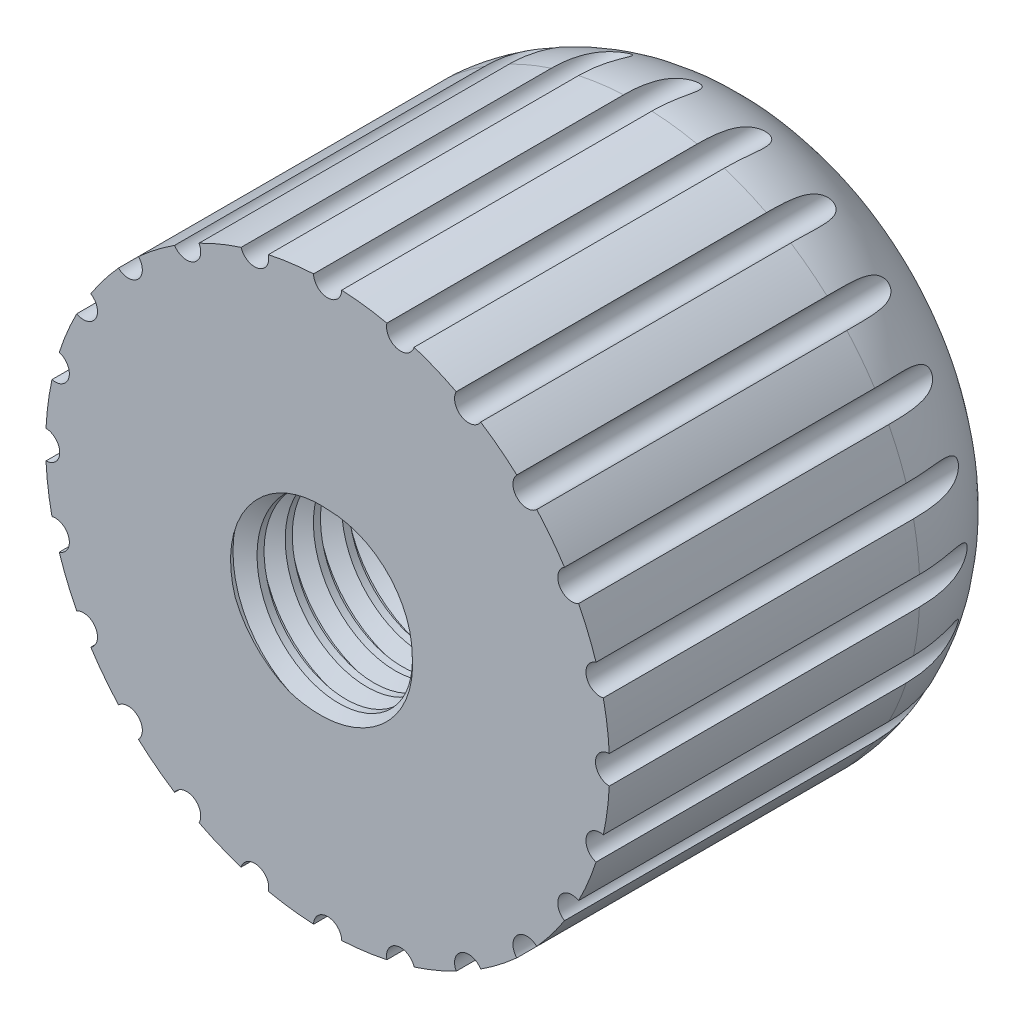
from build123d import *

# Parameters (mm, degrees)
SKETCH1_R           = 10
BOSS_EXTRUDE1_DEPTH = 16
SKETCH2_R           = 3
CUT_EXTRUDE1_DEPTH  = 12
THREAD1_PITCH       = 1
FILLET1_R           = 5
SKETCH6_R           = 0.5
CUT_EXTRUDE2_DEPTH  = 20
CIRPATTERN1_START   = -1e-07
CIRPATTERN1_DEPTH   = 17.0000001


with BuildPart() as part:
    # Sketch1 → Boss-Extrude1 (new body)
    with BuildSketch(Plane.XY):
        Circle(SKETCH1_R)
    extrude(amount=BOSS_EXTRUDE1_DEPTH)

    # Sketch2 → Cut-Extrude1 (cut)
    with BuildSketch(Plane.XY.offset(16)):
        Circle(SKETCH2_R)
    extrude(amount=-CUT_EXTRUDE1_DEPTH, mode=Mode.SUBTRACT)

    # Thread1: arcs per turn and ends read off the stored shape
    # Thread1: the profile of Thread Profile1 profile screwed along a right-hand helix through 12 turns, 8 arcs to a turn; built about Z, then put on its axis
    thread1_z = Axis((0, 0, 0), (0, 0, 1))
    thread1_corners = [(2.9997, 0, -0.000173205), (3.541265875, 0, 0.312499999), (3.541265875, 0, 0.437499999), (2.9997, 0, 0.750173202)]
    with BuildLine(mode=Mode.PRIVATE) as thread1_profile:
        Line(thread1_corners[0], thread1_corners[1])
        Line(thread1_corners[1], thread1_corners[2])
        Line(thread1_corners[2], thread1_corners[3])
        Line(thread1_corners[3], thread1_corners[0])
    thread1_cap = Face(thread1_profile.wire())
    thread1_turn_angles = [0, 22.5, 45, 67.5, 90, 112.5, 135, 157.5, 180, 202.5, 225, 247.5, 270, 292.5, 315, 337.5, 360]
    thread1_turn_weights = [1, 0.9238795325112867, 1, 0.9238795325112867, 1, 0.9238795325112867, 1, 0.9238795325112867, 1, 0.9238795325112867, 1, 0.9238795325112867, 1, 0.9238795325112867, 1, 0.9238795325112867, 1]
    thread1_turn_rails = [Edge.make_bspline([Vector(p[0], p[1], 0).rotate(thread1_z, thread1_turn_angles[k]) / thread1_turn_weights[k] + Vector(0, 0, p[2] + THREAD1_PITCH * thread1_turn_angles[k] / 360) for k in range(17)], [0, 0, 0, 1, 1, 2, 2, 3, 3, 4, 4, 5, 5, 6, 6, 7, 7, 8, 8, 8], 2, thread1_turn_weights) for p in thread1_corners]
    thread1_turn_sides = [Face.make_surface_from_curves(thread1_turn_rails[p[0]], thread1_turn_rails[p[1]]) for p in [(0, 1), (1, 2), (2, 3), (3, 0)]]
    thread1 = Plane(origin=(0, 0, 4), x_dir=(1, 0, 0), z_dir=(0, 0, 1)) * Solid(Shell([*[p.moved(Location((0, 0, THREAD1_PITCH * i))) for i in range(12) for p in thread1_turn_sides], thread1_cap, thread1_cap.rotate(thread1_z, 4320).moved(Location((0, 0, THREAD1_PITCH * 4320 / 360)))]))
    add(thread1, mode=Mode.SUBTRACT)

    # Fillet1
    fillet1_edges = [part.edges().sort_by_distance(p)[0] for p in [
        (-10, 0, 0),
    ]]
    fillet(fillet1_edges, radius=FILLET1_R)

    # Sketch6 → Cut-Extrude2 (cut)
    with BuildSketch(Plane.XY.offset(16)):
        with Locations((0, 10)):
            Circle(SKETCH6_R)
    extrude(amount=-CUT_EXTRUDE2_DEPTH, mode=Mode.SUBTRACT)

    # CirPattern1: read off the stored shape, not the designer's step
    # CirPattern1 outline → CirPattern1 (cut)
    with BuildSketch(Plane.XY.offset(CIRPATTERN1_START)):
        with BuildLine():
            ThreePointArc((3.067767176, 9.517815115), (2.588190451, 9.659258263), (2.102143249, 9.776553266))
            ThreePointArc((2.102143249, 9.776553266), (2.458780926, 9.17629535), (3.067767176, 9.517815115))
        make_face()
        with BuildLine():
            ThreePointArc((-2.102143249, 9.776553266), (-2.588190451, 9.659258263), (-3.067767177, 9.517815114))
            ThreePointArc((-3.067767177, 9.517815114), (-2.458780931, 9.176295349), (-2.102143249, 9.776553266))
        make_face()
        with BuildLine():
            ThreePointArc((-4.560872636, 8.899350583), (-5, 8.660254038), (-5.426627364, 8.399506858))
            ThreePointArc((-5.426627364, 8.399506858), (-4.750000002, 8.227241335), (-4.560872636, 8.899350583))
        make_face()
        with BuildLine():
            ThreePointArc((-6.70878609, 7.415671865), (-7.071067812, 7.071067812), (-7.415671865, 6.708786089))
            ThreePointArc((-7.415671865, 6.708786089), (-6.717514423, 6.71751442), (-6.70878609, 7.415671865))
        make_face()
        with BuildLine():
            ThreePointArc((-8.399506858, 5.426627364), (-8.660254038, 5), (-8.899350583, 4.560872636))
            ThreePointArc((-8.899350583, 4.560872636), (-8.227241337, 4.749999998), (-8.399506858, 5.426627364))
        make_face()
        with BuildLine():
            ThreePointArc((-9.517815115, 3.067767176), (-9.659258263, 2.588190451), (-9.776553266, 2.102143249))
            ThreePointArc((-9.776553266, 2.102143249), (-9.17629535, 2.458780926), (-9.517815115, 3.067767176))
        make_face()
        with BuildLine():
            ThreePointArc((-9.9875, 0.499843725), (-10, 0), (-9.9875, -0.499843725))
            ThreePointArc((-9.9875, -0.499843725), (-9.5, -2e-09), (-9.9875, 0.499843725))
        make_face()
        with BuildLine():
            ThreePointArc((-9.776553266, -2.102143249), (-9.659258263, -2.588190451), (-9.517815114, -3.067767177))
            ThreePointArc((-9.517815114, -3.067767177), (-9.176295349, -2.458780931), (-9.776553266, -2.102143249))
        make_face()
        with BuildLine():
            ThreePointArc((-8.899350583, -4.560872636), (-8.660254038, -5), (-8.399506858, -5.426627364))
            ThreePointArc((-8.399506858, -5.426627364), (-8.227241335, -4.750000002), (-8.899350583, -4.560872636))
        make_face()
        with BuildLine():
            ThreePointArc((-7.415671865, -6.70878609), (-7.071067812, -7.071067812), (-6.708786089, -7.415671865))
            ThreePointArc((-6.708786089, -7.415671865), (-6.71751442, -6.717514423), (-7.415671865, -6.70878609))
        make_face()
        with BuildLine():
            ThreePointArc((-5.426627364, -8.399506858), (-5, -8.660254038), (-4.560872636, -8.899350583))
            ThreePointArc((-4.560872636, -8.899350583), (-4.749999998, -8.227241337), (-5.426627364, -8.399506858))
        make_face()
        with BuildLine():
            ThreePointArc((-3.067767176, -9.517815115), (-2.588190451, -9.659258263), (-2.102143249, -9.776553266))
            ThreePointArc((-2.102143249, -9.776553266), (-2.458780926, -9.17629535), (-3.067767176, -9.517815115))
        make_face()
        with BuildLine():
            ThreePointArc((-0.499843725, -9.9875), (0, -10), (0.499843725, -9.9875))
            ThreePointArc((0.499843725, -9.9875), (2e-09, -9.5), (-0.499843725, -9.9875))
        make_face()
        with BuildLine():
            ThreePointArc((2.102143249, -9.776553266), (2.588190451, -9.659258263), (3.067767177, -9.517815114))
            ThreePointArc((3.067767177, -9.517815114), (2.458780931, -9.176295349), (2.102143249, -9.776553266))
        make_face()
        with BuildLine():
            ThreePointArc((4.560872636, -8.899350583), (5, -8.660254038), (5.426627364, -8.399506858))
            ThreePointArc((5.426627364, -8.399506858), (4.750000002, -8.227241335), (4.560872636, -8.899350583))
        make_face()
        with BuildLine():
            ThreePointArc((6.70878609, -7.415671865), (7.071067812, -7.071067812), (7.415671865, -6.708786089))
            ThreePointArc((7.415671865, -6.708786089), (6.717514423, -6.71751442), (6.70878609, -7.415671865))
        make_face()
        with BuildLine():
            ThreePointArc((8.399506858, -5.426627364), (8.660254038, -5), (8.899350583, -4.560872636))
            ThreePointArc((8.899350583, -4.560872636), (8.227241337, -4.749999998), (8.399506858, -5.426627364))
        make_face()
        with BuildLine():
            ThreePointArc((9.517815115, -3.067767176), (9.659258263, -2.588190451), (9.776553266, -2.102143249))
            ThreePointArc((9.776553266, -2.102143249), (9.17629535, -2.458780926), (9.517815115, -3.067767176))
        make_face()
        with BuildLine():
            ThreePointArc((9.9875, -0.499843725), (10, 0), (9.9875, 0.499843725))
            ThreePointArc((9.9875, 0.499843725), (9.5, 2e-09), (9.9875, -0.499843725))
        make_face()
        with BuildLine():
            ThreePointArc((9.776553266, 2.102143249), (9.659258263, 2.588190451), (9.517815114, 3.067767177))
            ThreePointArc((9.517815114, 3.067767177), (9.176295349, 2.458780931), (9.776553266, 2.102143249))
        make_face()
        with BuildLine():
            ThreePointArc((8.899350583, 4.560872636), (8.660254038, 5), (8.399506858, 5.426627364))
            ThreePointArc((8.399506858, 5.426627364), (8.227241335, 4.750000002), (8.899350583, 4.560872636))
        make_face()
        with BuildLine():
            ThreePointArc((7.415671865, 6.70878609), (7.071067812, 7.071067812), (6.708786089, 7.415671865))
            ThreePointArc((6.708786089, 7.415671865), (6.71751442, 6.717514423), (7.415671865, 6.70878609))
        make_face()
        with BuildLine():
            ThreePointArc((5.426627364, 8.399506858), (5, 8.660254038), (4.560872636, 8.899350583))
            ThreePointArc((4.560872636, 8.899350583), (4.749999998, 8.227241337), (5.426627364, 8.399506858))
        make_face()
    extrude(amount=CIRPATTERN1_DEPTH, mode=Mode.SUBTRACT)


solid = part.part
